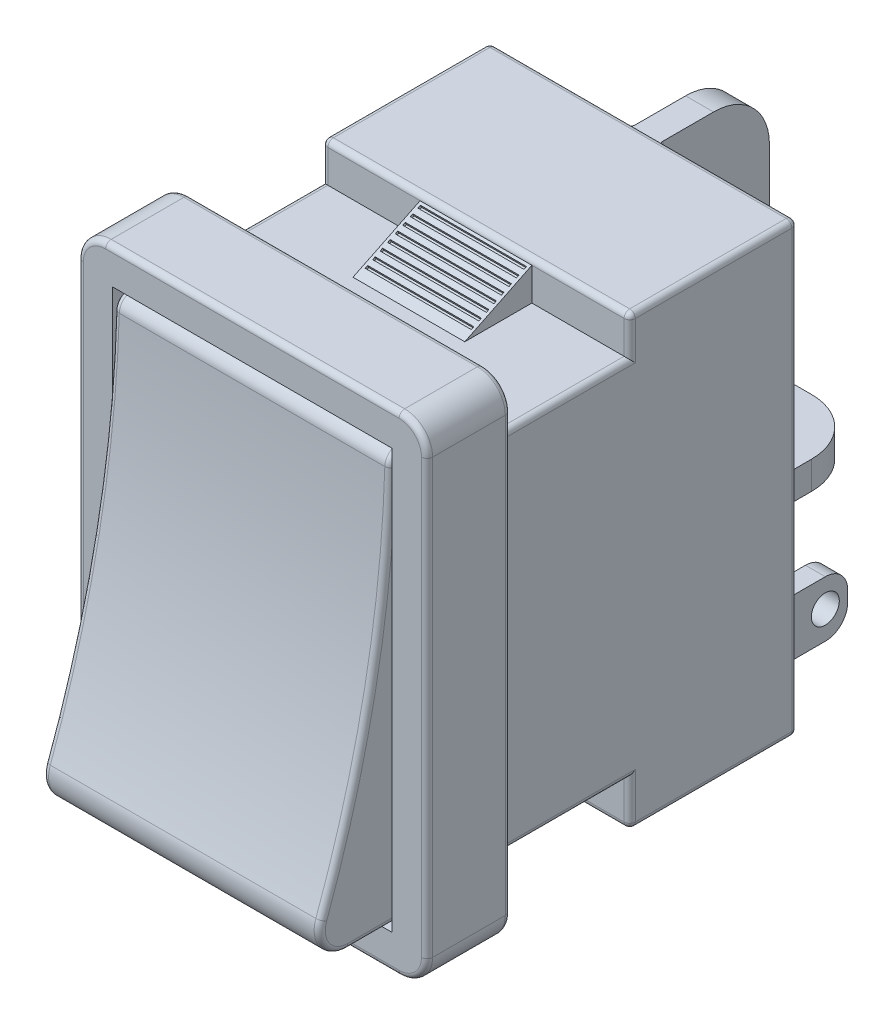
from build123d import *

# Parameters (mm, degrees)
SKETCH1_W           = 125
SKETCH1_H           = 175
BOSS_EXTRUDE1_DEPTH = 30
FILLET1_R           = 10
FILLET2_R           = 2
BOSS_EXTRUDE2_DEPTH = 55
FILLET3_R           = 2
BOSS_EXTRUDE3_DEPTH = 40
FILLET4_R           = 20
FILLET5_R           = 2
BOSS_EXTRUDE4_DEPTH = 20
SKETCH5_W           = 38
SKETCH5_H           = 1
CUT_EXTRUDE1_DEPTH  = 1
LPATTERN1_COUNT     = 8
LPATTERN1_PITCH     = 3
SKETCH6_W           = 7.108144549
SKETCH6_H           = 20
BOSS_EXTRUDE5_DEPTH = 30
FILLET6_R           = 8
SKETCH7_R           = 5
CUT_EXTRUDE2_DEPTH  = 30
SKETCH8_W           = 9.108144549
SKETCH8_H           = 22
SKETCH8_W_2         = 7.108144549
SKETCH8_H_2         = 20
BOSS_EXTRUDE6_DEPTH = 2
SKETCH9_W           = 100
SKETCH9_H           = 150
CUT_EXTRUDE3_DEPTH  = 20
BOSS_EXTRUDE7_DEPTH = 49.5
FILLET7_R           = 5
FILLET8_R           = 2


with BuildPart() as part:
    # Sketch1 → Boss-Extrude1 (new body)
    with BuildSketch(Plane.XY):
        Rectangle(SKETCH1_W, SKETCH1_H)
    extrude(amount=BOSS_EXTRUDE1_DEPTH)

    # Fillet1
    fillet1_edges = [part.edges().sort_by_distance(p)[0] for p in [
        (62.5, -87.5, 15),
        (-62.5, -87.5, 15),
        (-62.5, 87.5, 15),
        (62.5, 87.5, 15),
    ]]
    fillet(fillet1_edges, radius=FILLET1_R)

    # Fillet2
    fillet2_edges = [part.edges().sort_by_distance(p)[0] for p in [
        (-62.5, 0, 0),
        (-62.5, 0, 30),
        (62.5, 0, 0),
        (0, -87.5, 0),
        (0, 87.5, 0),
        (59.571067812, 84.571067812, 0),
        (59.571067812, -84.571067812, 0),
        (-59.571067812, -84.571067812, 0),
        (-59.571067812, 84.571067812, 0),
        (0, 87.5, 30),
        (62.5, 0, 30),
        (0, -87.5, 30),
        (59.571067812, 84.571067812, 30),
        (59.571067812, -84.571067812, 30),
        (-59.571067812, -84.571067812, 30),
        (-59.571067812, 84.571067812, 30),
    ]]
    fillet(fillet2_edges, radius=FILLET2_R)

    # Sketch2 → Boss-Extrude2 (add, symmetric)
    with BuildSketch(Plane(origin=(0, 0, 0), x_dir=(0, 0, -1), z_dir=(1, 0, 0))):
        Polygon((0, 65), (50, 65), (50, 78.705290734), (110, 78.705290734), (110, -81.294709266), (50, -81.294709266), (50, -65), (0, -65), align=None)
    extrude(amount=BOSS_EXTRUDE2_DEPTH, both=True)

    # Fillet3
    fillet3_edges = [part.edges().sort_by_distance(p)[0] for p in [
        (-55, 0, 0),
        (0, 65, 0),
        (-55, -65, -25),
        (0, -65, 0),
        (-55, -73.147354633, -50),
        (-55, -81.294709266, -80),
        (0, -81.294709266, -50),
        (-55, -1.294709266, -110),
        (0, -81.294709266, -110),
        (-55, 78.705290734, -80),
        (0, 78.705290734, -110),
        (-55, 71.852645367, -50),
        (0, 78.705290734, -50),
        (-55, 65, -25),
        (55, 0, 0),
        (55, -65, -25),
        (55, -73.147354633, -50),
        (55, -81.294709266, -80),
        (55, -1.294709266, -110),
        (55, 78.705290734, -80),
        (55, 71.852645367, -50),
        (55, 65, -25),
    ]]
    fillet(fillet3_edges, radius=FILLET3_R)

    # Sketch3 → Boss-Extrude3 (add)
    with BuildSketch(Plane(origin=(0, 0, -110), x_dir=(-1, 0, 0), z_dir=(0, 0, -1))):
        Polygon((-5, 76.705290734), (5, 76.705290734), (5, -13.294709266), (40.109505411, -13.294709266), (40.109505411, -23.294709266), (-40.109505411, -23.294709266), (-40.109505411, -13.294709266), (-5, -13.294709266), align=None)
    extrude(amount=BOSS_EXTRUDE3_DEPTH)

    # Fillet4
    fillet4_edges = [part.edges().sort_by_distance(p)[0] for p in [
        (40.109505411, -18.294709266, -150),
        (-40.109505411, -18.294709266, -150),
        (0, 76.705290734, -150),
    ]]
    fillet(fillet4_edges, radius=FILLET4_R)

    # Fillet5
    # the kernel refuses this fillet: 2 mm, written as the material it adds along each edge
    with BuildSketch(Plane(origin=(5, -18.294709266, -110), x_dir=(1, 0, 0), z_dir=(0, 1, 0))) as fillet5_piece_1:
        with BuildLine():
            CenterArc((FILLET5_R, FILLET5_R), FILLET5_R, 180, 90)
            Line((0, FILLET5_R), (0, 0))
            Line((0, 0), (FILLET5_R, 0))
        make_face()
    extrude(amount=95)
    with BuildSketch(Plane(origin=(40.109505411, -13.294709266, -110), x_dir=(0, 1, 0), z_dir=(-1, 0, 0)), Plane(origin=(0, -13.294709266, -110), x_dir=(0, 1, 0), z_dir=(-1, 0, 0))) as fillet5_piece_2:
        with BuildLine():
            CenterArc((FILLET5_R, FILLET5_R), FILLET5_R, 180, 90)
            Line((0, FILLET5_R), (0, 0))
            Line((0, 0), (FILLET5_R, 0))
        make_face()
    extrude(amount=40.109505411)
    with BuildSketch(Plane(origin=(40.109505411, -23.294709266, -110), x_dir=(1, 0, 0), z_dir=(0, 1, 0)), Plane(origin=(-40.109505411, -13.294709266, -110), x_dir=(-1, 0, 0), z_dir=(0, -1, 0))) as fillet5_piece_3:
        with BuildLine():
            CenterArc((FILLET5_R, FILLET5_R), FILLET5_R, 180, 90)
            Line((0, FILLET5_R), (0, 0))
            Line((0, 0), (FILLET5_R, 0))
        make_face()
    extrude(amount=10)
    with BuildSketch(Plane(origin=(-40.109505411, -23.294709266, -110), x_dir=(0, -1, 0), z_dir=(1, 0, 0))) as fillet5_piece_4:
        with BuildLine():
            CenterArc((FILLET5_R, FILLET5_R), FILLET5_R, 180, 90)
            Line((0, FILLET5_R), (0, 0))
            Line((0, 0), (FILLET5_R, 0))
        make_face()
    extrude(amount=80.219010822)
    with BuildSketch(Plane(origin=(-5, 76.705290734, -110), x_dir=(0, 0, -1), z_dir=(0, -1, 0))) as fillet5_piece_5:
        with BuildLine():
            CenterArc((FILLET5_R, -FILLET5_R), FILLET5_R, 90, 90)
            Line((0, -FILLET5_R), (0, 0))
            Line((0, 0), (FILLET5_R, 0))
        make_face()
    extrude(amount=95)
    with BuildSketch(Plane(origin=(40.109505411, -23.294709266, -110), x_dir=(1, 0, 0), z_dir=(0, 1, 0))) as fillet5_piece_6a_section:
        with BuildLine():
            CenterArc((FILLET5_R, FILLET5_R), FILLET5_R, 180, 90)
            Line((0, FILLET5_R), (0, 0))
            Line((0, 0), (FILLET5_R, 0))
        make_face()
    fillet5_piece_6a = extrude(amount=15, mode=Mode.PRIVATE)
    fillet5_piece_6a = split(fillet5_piece_6a, bisect_by=Plane(origin=(40.56229564, -13.294709266, -110.452790229), z_dir=(0, 1, 0)), keep=Keep.TOP, mode=Mode.PRIVATE)
    with BuildSketch(Plane(origin=(45.109505411, -13.294709266, -110), x_dir=(0, 1, 0), z_dir=(-1, 0, 0))) as fillet5_piece_6b_section:
        with BuildLine():
            CenterArc((FILLET5_R, FILLET5_R), FILLET5_R, 180, 90)
            Line((0, FILLET5_R), (0, 0))
            Line((0, 0), (FILLET5_R, 0))
        make_face()
    fillet5_piece_6b = extrude(amount=40.109505411, mode=Mode.PRIVATE)
    fillet5_piece_6b = split(fillet5_piece_6b, bisect_by=Plane(origin=(40.109505411, -12.841919037, -110.452790229), z_dir=(1, 0, 0)), keep=Keep.TOP, mode=Mode.PRIVATE)
    fillet5_piece_6 = fillet5_piece_6a & fillet5_piece_6b
    add(fillet5_piece_6)
    with BuildSketch(Plane(origin=(-40.109505411, -23.294709266, -110), x_dir=(0, -1, 0), z_dir=(1, 0, 0))) as fillet5_piece_7a_section:
        with BuildLine():
            CenterArc((FILLET5_R, FILLET5_R), FILLET5_R, 180, 90)
            Line((0, FILLET5_R), (0, 0))
            Line((0, 0), (FILLET5_R, 0))
        make_face()
    fillet5_piece_7a = extrude(amount=85.219010822, mode=Mode.PRIVATE)
    fillet5_piece_7a = split(fillet5_piece_7a, bisect_by=Plane(origin=(40.109505411, -23.747499494, -110.452790229), z_dir=(1, 0, 0)), keep=Keep.TOP, mode=Mode.PRIVATE)
    with BuildSketch(Plane(origin=(40.109505411, -28.294709266, -110), x_dir=(1, 0, 0), z_dir=(0, 1, 0))) as fillet5_piece_7b_section:
        with BuildLine():
            CenterArc((FILLET5_R, FILLET5_R), FILLET5_R, 180, 90)
            Line((0, FILLET5_R), (0, 0))
            Line((0, 0), (FILLET5_R, 0))
        make_face()
    fillet5_piece_7b = extrude(amount=15, mode=Mode.PRIVATE)
    fillet5_piece_7b = split(fillet5_piece_7b, bisect_by=Plane(origin=(40.56229564, -23.294709266, -110.452790229), z_dir=(0, -1, 0)), keep=Keep.TOP, mode=Mode.PRIVATE)
    fillet5_piece_7 = fillet5_piece_7a & fillet5_piece_7b
    add(fillet5_piece_7)
    with BuildSketch(Plane(origin=(-40.109505411, -13.294709266, -110), x_dir=(-1, 0, 0), z_dir=(0, -1, 0))) as fillet5_piece_8a_section:
        with BuildLine():
            CenterArc((FILLET5_R, FILLET5_R), FILLET5_R, 180, 90)
            Line((0, FILLET5_R), (0, 0))
            Line((0, 0), (FILLET5_R, 0))
        make_face()
    fillet5_piece_8a = extrude(amount=15, mode=Mode.PRIVATE)
    fillet5_piece_8a = split(fillet5_piece_8a, bisect_by=Plane(origin=(-40.56229564, -23.294709266, -110.452790229), z_dir=(0, -1, 0)), keep=Keep.TOP, mode=Mode.PRIVATE)
    with BuildSketch(Plane(origin=(-45.109505411, -23.294709266, -110), x_dir=(0, -1, 0), z_dir=(1, 0, 0))) as fillet5_piece_8b_section:
        with BuildLine():
            CenterArc((FILLET5_R, FILLET5_R), FILLET5_R, 180, 90)
            Line((0, FILLET5_R), (0, 0))
            Line((0, 0), (FILLET5_R, 0))
        make_face()
    fillet5_piece_8b = extrude(amount=85.219010822, mode=Mode.PRIVATE)
    fillet5_piece_8b = split(fillet5_piece_8b, bisect_by=Plane(origin=(-40.109505411, -23.747499494, -110.452790229), z_dir=(-1, 0, 0)), keep=Keep.TOP, mode=Mode.PRIVATE)
    fillet5_piece_8 = fillet5_piece_8a & fillet5_piece_8b
    add(fillet5_piece_8)
    with BuildSketch(Plane(origin=(-5, -13.294709266, -110), x_dir=(0, 1, 0), z_dir=(-1, 0, 0))) as fillet5_piece_9a_section:
        with BuildLine():
            CenterArc((FILLET5_R, FILLET5_R), FILLET5_R, 180, 90)
            Line((0, FILLET5_R), (0, 0))
            Line((0, 0), (FILLET5_R, 0))
        make_face()
    fillet5_piece_9a = extrude(amount=40.109505411, mode=Mode.PRIVATE)
    fillet5_piece_9a = split(fillet5_piece_9a, bisect_by=Plane(origin=(-40.109505411, -12.841919037, -110.452790229), z_dir=(-1, 0, 0)), keep=Keep.TOP, mode=Mode.PRIVATE)
    with BuildSketch(Plane(origin=(-40.109505411, -8.294709266, -110), x_dir=(-1, 0, 0), z_dir=(0, -1, 0))) as fillet5_piece_9b_section:
        with BuildLine():
            CenterArc((FILLET5_R, FILLET5_R), FILLET5_R, 180, 90)
            Line((0, FILLET5_R), (0, 0))
            Line((0, 0), (FILLET5_R, 0))
        make_face()
    fillet5_piece_9b = extrude(amount=15, mode=Mode.PRIVATE)
    fillet5_piece_9b = split(fillet5_piece_9b, bisect_by=Plane(origin=(-40.56229564, -13.294709266, -110.452790229), z_dir=(0, 1, 0)), keep=Keep.TOP, mode=Mode.PRIVATE)
    fillet5_piece_9 = fillet5_piece_9a & fillet5_piece_9b
    add(fillet5_piece_9)

    # Sketch4 → Boss-Extrude4 (add, symmetric)
    with BuildSketch(Plane(origin=(0, 0, 0), x_dir=(0, 0, -1), z_dir=(1, 0, 0))):
        Polygon((50, 76.705290734), (26, 65), (50, 65), align=None)
    extrude(amount=BOSS_EXTRUDE4_DEPTH, both=True)

    # Sketch5 → Cut-Extrude1 (cut)
    with BuildSketch(Plane(origin=(0, 42.265517531, 20.613757114), x_dir=(1, 0, 0), z_dir=(0, 0.8987983458700283, 0.43836233125269924))):
        with Locations((0, 77.064627359)):
            Rectangle(SKETCH5_W, SKETCH5_H)
    cut_extrude1 = extrude(amount=-CUT_EXTRUDE1_DEPTH, mode=Mode.SUBTRACT)

    # LPattern1: Cut-Extrude1 ×8
    with Locations(*[Vector(0, -0.4383623312526987, 0.8987983458700285) * (i * LPATTERN1_PITCH) for i in range(1, LPATTERN1_COUNT)]):
        add(cut_extrude1, mode=Mode.SUBTRACT)

    # Sketch8 → Boss-Extrude6 (add)
    with BuildSketch(Plane(origin=(0, 0, -110), x_dir=(-1, 0, 0), z_dir=(0, 0, -1))):
        with Locations((-39.445927725, -59.294709266)):
            Rectangle(SKETCH8_W, SKETCH8_H)
        with Locations((-39.445927725, -59.294709266)):
            Rectangle(SKETCH8_W_2, SKETCH8_H_2, mode=Mode.SUBTRACT)
    boss_extrude6 = extrude(amount=BOSS_EXTRUDE6_DEPTH)

    # Mirror1: Boss-Extrude6 across plane
    add(boss_extrude6.mirror(Plane(origin=(0, 0, 0), x_dir=(0, 0, 1), z_dir=(1, 0, 0))))

    # Sketch9 → Cut-Extrude3 (cut)
    with BuildSketch(Plane.XY.offset(30)):
        Rectangle(SKETCH9_W, SKETCH9_H)
    extrude(amount=-CUT_EXTRUDE3_DEPTH, mode=Mode.SUBTRACT)


with BuildPart() as body_2:
    # Sketch6 → Boss-Extrude5 (new body)
    with BuildSketch(Plane(origin=(0, 0, -110), x_dir=(-1, 0, 0), z_dir=(0, 0, -1))):
        with Locations((-39.445927725, -59.294709266)):
            Rectangle(SKETCH6_W, SKETCH6_H)
    extrude(amount=BOSS_EXTRUDE5_DEPTH)

    # Fillet6
    fillet6_edges = [body_2.edges().sort_by_distance(p)[0] for p in [
        (39.445927726, -49.294709266, -140),
        (39.445927726, -69.294709266, -140),
    ]]
    fillet(fillet6_edges, radius=FILLET6_R)

    # Sketch7 → Cut-Extrude2 (cut)
    with BuildSketch(Plane(origin=(43, 0, 0), x_dir=(0, 0, -1), z_dir=(1, 0, 0))):
        with Locations((132, -59.294709266)):
            Circle(SKETCH7_R)
    extrude(amount=-CUT_EXTRUDE2_DEPTH, mode=Mode.SUBTRACT)


with BuildPart() as body_3:
    # Mirror2: mirrored copy
    add(body_2.part.mirror(Plane(origin=(0, 0, 0), x_dir=(0, 0, 1), z_dir=(1, 0, 0))))


with BuildPart() as body_4:
    # Sketch10 → Boss-Extrude7 (new, symmetric)
    with BuildSketch(Plane(origin=(0, 0, 0), x_dir=(0, 0, -1), z_dir=(1, 0, 0))):
        with BuildLine():
            Line((-30, 73), (-10, 73))
            Line((-10, 73), (-10, -73))
            Line((-10, -73), (-45.399858274, -73))
            ThreePointArc((-45.399858274, -73), (-53.599880036, -68.723604031), (-54.786593796, -59.55192862))
            ThreePointArc((-54.786593796, -59.55192862), (-36.840585794, 5.685704554), (-30, 73))
        make_face()
    extrude(amount=BOSS_EXTRUDE7_DEPTH, both=True)

    # Fillet7
    fillet7_edges = [body_4.edges().sort_by_distance(p)[0] for p in [
        (0, 73, 30),
    ]]
    fillet(fillet7_edges, radius=FILLET7_R)

    # Fillet8
    fillet8_edges = [body_4.edges().sort_by_distance(p)[0] for p in [
        (49.5, -73, 27.699929137),
        (49.5, 73, 17.558544699),
        (-49.5, 3.301853126, 37.293746381),
        (49.5, 3.301853126, 37.293746381),
        (-49.5, 71.587582575, 28.59979686),
        (49.5, 71.587582575, 28.59979686),
        (-49.5, 73, 17.558544699),
        (-49.5, -73, 27.699929137),
        (-49.5, -68.723604031, 53.599880036),
        (49.5, -68.723604031, 53.599880036),
    ]]
    fillet(fillet8_edges, radius=FILLET8_R)


solid = Compound([part.part, body_2.part, body_3.part, body_4.part])
